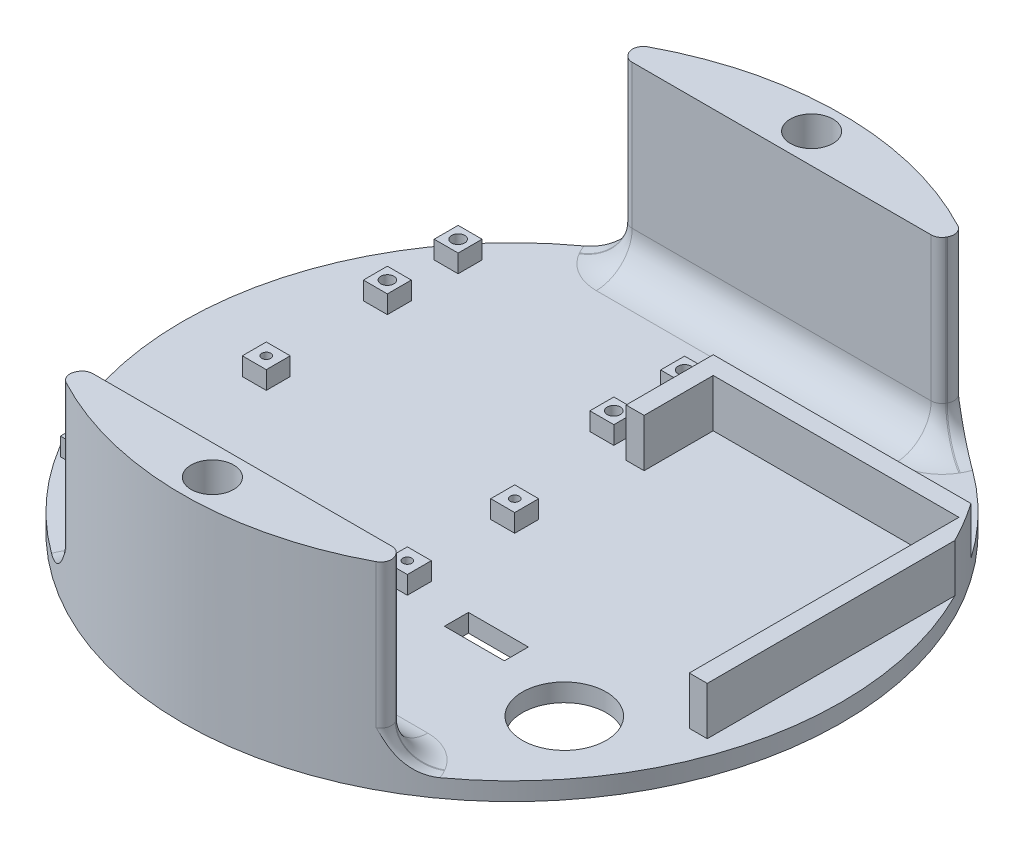
from build123d import *
from build123d.topology import SkipClean

# Parameters (mm, degrees)
SKETCH1_R           = 69.85
BOSS_EXTRUDE1_DEPTH = 3.81
BOSS_EXTRUDE2_DEPTH = 38.1
FILLET1_R           = 2.286
FILLET2_R           = 7.62
SKETCH3_R           = 4.5085
CUT_EXTRUDE1_DEPTH  = 108.305606163
SKETCH4_R           = 1.397
SKETCH4_R_2         = 0.950000005
SKETCH4_R_3         = 8.89
CUT_EXTRUDE2_DEPTH  = 106.875658305
BOSS_EXTRUDE3_START = 3.81
SKETCH5_W           = 5.08
SKETCH5_H           = 5.08
SKETCH5_R           = 0.950000005
SKETCH5_R_2         = 1.397
BOSS_EXTRUDE3_DEPTH = 3.81
BOSS_EXTRUDE4_DEPTH = 10.16
SKETCH7_W           = 12.7
SKETCH7_H           = 5.08
SKETCH7_W_2         = 35.56
CUT_EXTRUDE3_DEPTH  = 106.875658305


with BuildPart() as part:
    # Sketch1 → Boss-Extrude1 (new body)
    with BuildSketch(Plane(origin=(0, 0, 0), x_dir=(1, 0, 0), z_dir=(0, 1, 0))):
        with Locations(Location((0, 0, 0), (0, 0, 90))):
            Circle(SKETCH1_R)
    extrude(amount=BOSS_EXTRUDE1_DEPTH)

    # Sketch2 → Boss-Extrude2 (add)
    with SkipClean():  # the faces are left unmerged after this step: merging them gives an invalid solid
        with BuildSketch(Plane(origin=(0, 3.81, 0), x_dir=(1, 0, 0), z_dir=(0, 1, 0))):
            with BuildLine():
                Line((-32.995567884, 57.15), (32.995567884, 57.15))
                Line((32.995567884, 57.15), (34.925, 60.491874454))
                ThreePointArc((34.925, 60.491874454), (0, 69.85), (-34.925, 60.491874454))
                Line((-34.925, 60.491874454), (-32.995567884, 57.15))
            make_face()
            with BuildLine():
                Line((-34.925, -60.491874454), (-32.995567884, -57.15))
                Line((-32.995567884, -57.15), (32.995567884, -57.15))
                Line((32.995567884, -57.15), (34.925, -60.491874454))
                ThreePointArc((34.925, -60.491874454), (0, -69.85), (-34.925, -60.491874454))
            make_face()
        extrude(amount=BOSS_EXTRUDE2_DEPTH)

    # Fillet1
    # the kernel refuses this fillet: 2.286 mm, written as the material it takes off along each edge
    with BuildSketch(Plane(origin=(-34.925, 3.81, 60.491874454), x_dir=(0.8743612910695221, 0, 0.48527552243981803), z_dir=(0, 1, 0)), Plane(origin=(34.925, 3.81, -60.491874454), x_dir=(-0.8743612910695224, 0, -0.48527552243981753), z_dir=(0, 1, 0))) as fillet1_piece_1:
        with BuildLine():
            CenterArc((2.325005754, 2.285672762), FILLET1_R, 179.030525465, 91.938949071)
            Line((0.039332991, 2.324351231), (0, 0))
            ThreePointArc((0, 0), (1.181842111, -0.009998932), (2.363684223, 0))
        make_face()
    extrude(amount=44.009210557, mode=Mode.SUBTRACT)
    with BuildSketch(Plane(origin=(34.925, 3.81, 60.491874454), x_dir=(-0.8743612910695224, 0, 0.48527552243981753), z_dir=(0, 1, 0)), Plane(origin=(-34.925, 3.81, -60.491874454), x_dir=(0.8743612910695221, 0, -0.48527552243981803), z_dir=(0, 1, 0))) as fillet1_piece_2:
        with BuildLine():
            CenterArc((2.325005754, -2.285672762), FILLET1_R, 89.030525465, 91.938949071)
            Line((0.039332991, -2.324351231), (0, 0))
            ThreePointArc((0, 0), (1.181842111, 0.009998932), (2.363684223, 0))
        make_face()
    extrude(amount=44.009210557, mode=Mode.SUBTRACT)
    with BuildSketch(Plane(origin=(32.995567884, 3.81, 57.15), x_dir=(0.5000000000000007, 0, 0.8660254037844384), z_dir=(0, 1, 0)), Plane(origin=(-32.995567884, 3.81, 57.15), x_dir=(1, 0, 0), z_dir=(0, 1, 0)), Plane(origin=(-32.995567884, 3.81, -57.15), x_dir=(-0.49999999999999833, 0, -0.8660254037844397), z_dir=(0, 1, 0))) as fillet1_piece_3:
        with BuildLine():
            CenterArc((FILLET1_R * 0.57735026919, -FILLET1_R), FILLET1_R, 90, 60)
            Line((-FILLET1_R * 0.288675134595, -FILLET1_R * 0.5), (0, 0))
            Line((0, 0), (FILLET1_R * 0.57735026919, 0))
        make_face()
    extrude(amount=41.399556788, mode=Mode.SUBTRACT)
    with BuildSketch(Plane(origin=(32.995567884, 3.81, -57.15), x_dir=(0.5000000000000007, 0, -0.8660254037844384), z_dir=(0, 1, 0))) as fillet1_piece_4:
        with BuildLine():
            CenterArc((FILLET1_R * 0.57735026919, FILLET1_R), FILLET1_R, 210, 60)
            Line((-FILLET1_R * 0.288675134595, FILLET1_R * 0.5), (0, 0))
            Line((0, 0), (FILLET1_R * 0.57735026919, 0))
        make_face()
    extrude(amount=41.399556788, mode=Mode.SUBTRACT)

    # Fillet2
    # the kernel refuses this fillet: 7.62 mm, written as the material it adds along each edge
    with BuildSketch(Plane(origin=(33.655479242, 3.81, -58.293), x_dir=(0.8660254037844389, 0, 0.49999999999999933), z_dir=(0.4999999999999994, 0, -0.866025403784439)), Plane(origin=(-33.762657997, 3.81, -58.478639049), x_dir=(-0.8660254037844389, 0, 0.49999999999999933), z_dir=(0.4999999999999994, 0, 0.866025403784439))) as fillet2_piece_1:
        with BuildLine():
            CenterArc((FILLET2_R, -FILLET2_R), FILLET2_R, 90, 90)
            Line((0, -FILLET2_R), (0, 0))
            Line((0, 0), (FILLET2_R, 0))
        make_face()
    extrude(amount=0.21435751)
    with BuildSketch(Plane(origin=(-31.675745169, 3.81, -57.15), x_dir=(0, 0, 1), z_dir=(1, 0, 0))) as fillet2_piece_2:
        with BuildLine():
            CenterArc((FILLET2_R, -FILLET2_R), FILLET2_R, 90, 90)
            Line((0, -FILLET2_R), (0, 0))
            Line((0, 0), (FILLET2_R, 0))
        make_face()
    extrude(amount=63.351490338)
    with BuildSketch(Plane(origin=(-33.762657997, 3.81, 58.478639049), x_dir=(-0.8660254037844389, 0, -0.49999999999999933), z_dir=(0.4999999999999994, 0, -0.866025403784439)), Plane(origin=(33.655479242, 3.81, 58.293), x_dir=(0.8660254037844389, 0, -0.49999999999999933), z_dir=(0.4999999999999994, 0, 0.866025403784439))) as fillet2_piece_3:
        with BuildLine():
            CenterArc((FILLET2_R, FILLET2_R), FILLET2_R, 180, 90)
            Line((0, FILLET2_R), (0, 0))
            Line((0, 0), (FILLET2_R, 0))
        make_face()
    extrude(amount=0.21435751)
    with BuildSketch(Plane(origin=(-31.675745169, 3.81, 57.15), x_dir=(0, 0, -1), z_dir=(1, 0, 0))) as fillet2_piece_4:
        with BuildLine():
            CenterArc((FILLET2_R, FILLET2_R), FILLET2_R, 180, 90)
            Line((0, FILLET2_R), (0, 0))
            Line((0, 0), (FILLET2_R, 0))
        make_face()
    extrude(amount=63.351490338)
    with BuildSketch(Plane(origin=(31.782923924, 3.81, -59.621639049), x_dir=(0.8660254037844924, 0, 0.49999999999990685), z_dir=(-0.49999999999990685, 0, 0.8660254037844924))) as fillet2_piece_5_section:
        with BuildLine():
            CenterArc((2.286 + FILLET2_R, FILLET2_R), FILLET2_R, 180, 90)
            Line((2.286, FILLET2_R), (2.286, 0))
            Line((2.286, 0), (2.286 + FILLET2_R, 0))
        make_face()
    fillet2_piece_5 = revolve(axis=Axis((31.782923924, 3.81, -59.621639049), (0, 1, 0)), revolution_arc=359.64, mode=Mode.PRIVATE)
    fillet2_piece_5 = fillet2_piece_5 & Plane(origin=(0, 3.81, 0), x_dir=(0, 0, -1), z_dir=(0, -1, 0)) * Cylinder(69.85, 40, mode=Mode.PRIVATE)
    add(fillet2_piece_5)
    with BuildSketch(Plane(origin=(31.675745169, 3.81, -59.436), x_dir=(0, 0, 1), z_dir=(-1, 0, 0))) as fillet2_piece_6:
        with BuildLine():
            CenterArc((2.286 + FILLET2_R, FILLET2_R), FILLET2_R, 180, 90)
            Line((2.286, FILLET2_R), (2.286, 0))
            Line((2.286, 0), (2.286 + FILLET2_R, 0))
        make_face()
    revolve(axis=Axis((31.675745169, 3.81, -59.436), (0, 1, 0)), revolution_arc=60)
    with BuildSketch(Plane(origin=(-31.675745169, 3.81, -59.436), x_dir=(-0.8660254037843292, 0, 0.5000000000001897), z_dir=(-0.5000000000001897, 0, -0.8660254037843292))) as fillet2_piece_7:
        with BuildLine():
            CenterArc((2.286 + FILLET2_R, FILLET2_R), FILLET2_R, 180, 90)
            Line((2.286, FILLET2_R), (2.286, 0))
            Line((2.286, 0), (2.286 + FILLET2_R, 0))
        make_face()
    revolve(axis=Axis((-31.675745169, 3.81, -59.436), (0, 1, 0)), revolution_arc=60)
    with BuildSketch(Plane(origin=(-31.782923924, 3.81, -59.621639049), x_dir=(-0.8628667372016797, 0, 0.5054314927177838), z_dir=(-0.5054314927177838, 0, -0.8628667372016797))) as fillet2_piece_8_section:
        with BuildLine():
            CenterArc((2.286 + FILLET2_R, FILLET2_R), FILLET2_R, 180, 90)
            Line((2.286, FILLET2_R), (2.286, 0))
            Line((2.286, 0), (2.286 + FILLET2_R, 0))
        make_face()
    fillet2_piece_8 = revolve(axis=Axis((-31.782923924, 3.81, -59.621639049), (0, 1, 0)), revolution_arc=359.64, mode=Mode.PRIVATE)
    fillet2_piece_8 = fillet2_piece_8 & Plane(origin=(0, 3.81, 0), x_dir=(0, 0, -1), z_dir=(0, -1, 0)) * Cylinder(69.85, 40, mode=Mode.PRIVATE)
    add(fillet2_piece_8)
    with BuildSketch(Plane(origin=(-31.675745169, 3.81, 59.436), x_dir=(0, 0, -1), z_dir=(1, 0, 0))) as fillet2_piece_9:
        with BuildLine():
            CenterArc((2.286 + FILLET2_R, FILLET2_R), FILLET2_R, 180, 90)
            Line((2.286, FILLET2_R), (2.286, 0))
            Line((2.286, 0), (2.286 + FILLET2_R, 0))
        make_face()
    revolve(axis=Axis((-31.675745169, 3.81, 59.436), (0, 1, 0)), revolution_arc=60)
    with BuildSketch(Plane(origin=(-31.782923924, 3.81, 59.621639049), x_dir=(-0.8660254037844924, 0, -0.49999999999990685), z_dir=(0.49999999999990685, 0, -0.8660254037844924))) as fillet2_piece_10_section:
        with BuildLine():
            CenterArc((2.286 + FILLET2_R, FILLET2_R), FILLET2_R, 180, 90)
            Line((2.286, FILLET2_R), (2.286, 0))
            Line((2.286, 0), (2.286 + FILLET2_R, 0))
        make_face()
    fillet2_piece_10 = revolve(axis=Axis((-31.782923924, 3.81, 59.621639049), (0, 1, 0)), revolution_arc=359.64, mode=Mode.PRIVATE)
    fillet2_piece_10 = fillet2_piece_10 & Plane(origin=(0, 3.81, 0), x_dir=(0, 0, -1), z_dir=(0, -1, 0)) * Cylinder(69.85, 40, mode=Mode.PRIVATE)
    add(fillet2_piece_10)
    with BuildSketch(Plane(origin=(31.675745169, 3.81, 59.436), x_dir=(0.8660254037843292, 0, -0.5000000000001897), z_dir=(0.5000000000001897, 0, 0.8660254037843292))) as fillet2_piece_11:
        with BuildLine():
            CenterArc((2.286 + FILLET2_R, FILLET2_R), FILLET2_R, 180, 90)
            Line((2.286, FILLET2_R), (2.286, 0))
            Line((2.286, 0), (2.286 + FILLET2_R, 0))
        make_face()
    revolve(axis=Axis((31.675745169, 3.81, 59.436), (0, 1, 0)), revolution_arc=60)
    with BuildSketch(Plane(origin=(31.782923924, 3.81, 59.621639049), x_dir=(0.8628667372016707, 0, -0.5054314927177995), z_dir=(0.5054314927177995, 0, 0.8628667372016707))) as fillet2_piece_12_section:
        with BuildLine():
            CenterArc((2.286 + FILLET2_R, FILLET2_R), FILLET2_R, 180, 90)
            Line((2.286, FILLET2_R), (2.286, 0))
            Line((2.286, 0), (2.286 + FILLET2_R, 0))
        make_face()
    fillet2_piece_12 = revolve(axis=Axis((31.782923924, 3.81, 59.621639049), (0, 1, 0)), revolution_arc=359.64, mode=Mode.PRIVATE)
    fillet2_piece_12 = fillet2_piece_12 & Plane(origin=(0, 3.81, 0), x_dir=(0, 0, -1), z_dir=(0, -1, 0)) * Cylinder(69.85, 40, mode=Mode.PRIVATE)
    add(fillet2_piece_12)

    # Sketch3 → Cut-Extrude1 (cut, through all)
    with BuildSketch(Plane(origin=(0, 41.91, 0), x_dir=(1, 0, 0), z_dir=(0, 1, 0))):
        with Locations(Location((0, 63.5, 0), (0, 0, 270))):
            Circle(SKETCH3_R)
        with Locations(Location((0, -63.5, 0), (0, 0, 270))):
            Circle(SKETCH3_R)
    extrude(amount=-CUT_EXTRUDE1_DEPTH, mode=Mode.SUBTRACT)

    # Sketch4 → Cut-Extrude2 (cut, through all)
    with BuildSketch(Plane(origin=(0, 3.81, 0), x_dir=(1, 0, 0), z_dir=(0, 1, 0))):
        with Locations(Location((-51.94, 25.52, 0), (0, 0, 270))):
            Circle(SKETCH4_R)
        with Locations(Location((-51.94, 40.52, 0), (0, 0, 270))):
            Circle(SKETCH4_R)
        with Locations(Location((-3.94, 25.52, 0), (0, 0, 270))):
            Circle(SKETCH4_R)
        with Locations(Location((-3.94, 40.52, 0), (0, 0, 270))):
            Circle(SKETCH4_R)
        with Locations(Location((-55.415140337, -35.214390074, 0), (0, 0, 270))):
            Circle(SKETCH4_R_2)
        with Locations(Location((-50.865140293, -1.214390002, 0), (0, 0, 270))):
            Circle(SKETCH4_R_2)
        with Locations(Location((1.684859763, -1.114389948, 0), (0, 0, 270))):
            Circle(SKETCH4_R_2)
        with Locations(Location((1.684859763, -23.865169948, 0), (0, 0, 270))):
            Circle(SKETCH4_R_2)
        with Locations(Location((43.046859843, -31.965170004, 0), (0, 0, 270))):
            Circle(SKETCH4_R_3)
    extrude(amount=-CUT_EXTRUDE2_DEPTH, mode=Mode.SUBTRACT)

    # Sketch5 → Boss-Extrude3 (add)
    # profile 1 of 8: a face of its own
    with BuildSketch(Plane(origin=(0, 3.81, 0), x_dir=(1, 0, 0), z_dir=(0, 1, 0)).offset(BOSS_EXTRUDE3_START)):
        with Locations((-50.865140293, -1.214390002)):
            Rectangle(SKETCH5_W, SKETCH5_H)
        with Locations(Location((-50.865140293, -1.214390002, 0), (0, 0, 270))):
            Circle(SKETCH5_R, mode=Mode.SUBTRACT)
    # profile 2 of 8: a face of its own
    with BuildSketch(Plane(origin=(0, 3.81, 0), x_dir=(1, 0, 0), z_dir=(0, 1, 0)).offset(BOSS_EXTRUDE3_START)):
        with Locations((-55.415140337, -35.214390074)):
            Rectangle(SKETCH5_W, SKETCH5_H)
        with Locations(Location((-55.415140337, -35.214390074, 0), (0, 0, 270))):
            Circle(SKETCH5_R, mode=Mode.SUBTRACT)
    # profile 3 of 8: a face of its own
    with BuildSketch(Plane(origin=(0, 3.81, 0), x_dir=(1, 0, 0), z_dir=(0, 1, 0)).offset(BOSS_EXTRUDE3_START)):
        with Locations((1.684859763, -23.865169948)):
            Rectangle(SKETCH5_W, SKETCH5_H)
        with Locations(Location((1.684859763, -23.865169948, 0), (0, 0, 270))):
            Circle(SKETCH5_R, mode=Mode.SUBTRACT)
    # profile 4 of 8: a face of its own
    with BuildSketch(Plane(origin=(0, 3.81, 0), x_dir=(1, 0, 0), z_dir=(0, 1, 0)).offset(BOSS_EXTRUDE3_START)):
        with Locations((1.684859763, -1.114389948)):
            Rectangle(SKETCH5_W, SKETCH5_H)
        with Locations(Location((1.684859763, -1.114389948, 0), (0, 0, 270))):
            Circle(SKETCH5_R, mode=Mode.SUBTRACT)
    # profile 5 of 8: a face of its own
    with BuildSketch(Plane(origin=(0, 3.81, 0), x_dir=(1, 0, 0), z_dir=(0, 1, 0)).offset(BOSS_EXTRUDE3_START)):
        with Locations((-3.94, 25.52)):
            Rectangle(SKETCH5_W, SKETCH5_H)
        with Locations(Location((-3.94, 25.52, 0), (0, 0, 270))):
            Circle(SKETCH5_R_2, mode=Mode.SUBTRACT)
    # profile 6 of 8: a face of its own
    with BuildSketch(Plane(origin=(0, 3.81, 0), x_dir=(1, 0, 0), z_dir=(0, 1, 0)).offset(BOSS_EXTRUDE3_START)):
        with Locations((-3.94, 40.52)):
            Rectangle(SKETCH5_W, SKETCH5_H)
        with Locations(Location((-3.94, 40.52, 0), (0, 0, 270))):
            Circle(SKETCH5_R_2, mode=Mode.SUBTRACT)
    # profile 7 of 8: a face of its own
    with BuildSketch(Plane(origin=(0, 3.81, 0), x_dir=(1, 0, 0), z_dir=(0, 1, 0)).offset(BOSS_EXTRUDE3_START)):
        with Locations((-51.94, 40.52)):
            Rectangle(SKETCH5_W, SKETCH5_H)
        with Locations(Location((-51.94, 40.52, 0), (0, 0, 270))):
            Circle(SKETCH5_R_2, mode=Mode.SUBTRACT)
    # profile 8 of 8: a face of its own
    with BuildSketch(Plane(origin=(0, 3.81, 0), x_dir=(1, 0, 0), z_dir=(0, 1, 0)).offset(BOSS_EXTRUDE3_START)):
        with Locations((-51.94, 25.52)):
            Rectangle(SKETCH5_W, SKETCH5_H)
        with Locations(Location((-51.94, 25.52, 0), (0, 0, 270))):
            Circle(SKETCH5_R_2, mode=Mode.SUBTRACT)
    extrude(amount=-BOSS_EXTRUDE3_DEPTH)

    # Sketch6 → Boss-Extrude4 (add)
    with BuildSketch(Plane(origin=(0, 3.81, 0), x_dir=(1, 0, 0), z_dir=(0, 1, 0))):
        with BuildLine():
            Line((2.643362806, 21.5376763), (2.643362806, 40.002627976))
            Line((2.643362806, 40.002627976), (57.260913851, 40.002627976))
            ThreePointArc((57.260913851, 40.002627976), (59.947328484, 35.851643026), (62.333362806, 31.521014915))
            Line((62.333362806, 31.521014915), (62.333362806, -20.957372024))
            Line((62.333362806, -20.957372024), (58.523362806, -20.957372024))
            Line((58.523362806, -20.957372024), (58.523362806, 36.192627976))
            Line((58.523362806, 36.192627976), (6.453362806, 36.192627976))
            Line((6.453362806, 36.192627976), (6.453362806, 21.5376763))
            Line((6.453362806, 21.5376763), (2.643362806, 21.5376763))
        make_face()
    extrude(amount=BOSS_EXTRUDE4_DEPTH)

    # Sketch7 → Cut-Extrude3 (cut, through all)
    with BuildSketch(Plane(origin=(0, 3.81, 0), x_dir=(1, 0, 0), z_dir=(0, 1, 0))):
        with Locations((20.186859843, -25.615170004)):
            Rectangle(SKETCH7_W, SKETCH7_H)
        with Locations((31.616859843, 42.542627976)):
            Rectangle(SKETCH7_W_2, SKETCH7_H)
    extrude(amount=-CUT_EXTRUDE3_DEPTH, mode=Mode.SUBTRACT)


solid = part.part
